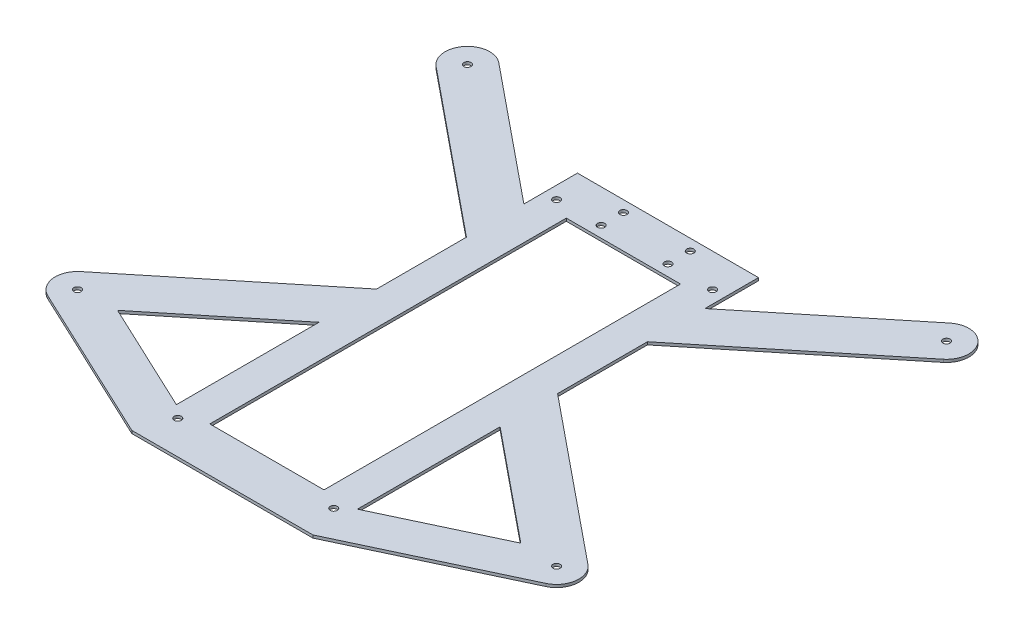
from build123d import *

# Parameters (mm, degrees)
SKETCH2_R           = 2.032
SKETCH2_W           = 65.0875
SKETCH2_H           = 203.2
BOSS_EXTRUDE1_DEPTH = 0.79375
SKETCH3_R           = 2.032
CUT_EXTRUDE1_DEPTH  = 223.550288208


with BuildPart() as part:
    # Sketch2 → Boss-Extrude1 (new, symmetric)
    with BuildSketch(Plane(origin=(0, 0, 0), x_dir=(1, 0, 0), z_dir=(0, 1, 0))):
        with BuildLine():
            Line((-51.59375, 58.370134809), (-128.507853241, 120.974637447))
            ThreePointArc((-128.507853241, 120.974637447), (-146.374637447, 119.142146759), (-144.542146759, 101.275362553))
            Line((-144.542146759, 101.275362553), (-51.59375, 25.619690772))
            Line((-51.59375, 25.619690772), (-51.59375, -25.619690772))
            Line((-51.59375, -25.619690772), (-144.542146759, -101.275362553))
            ThreePointArc((-144.542146759, -101.275362553), (-149.130906335, -112.668089589), (-141.929642552, -122.617599309))
            Line((-141.929642552, -122.617599309), (-51.59375, -165.1))
            Line((-51.59375, -165.1), (51.59375, -165.1))
            Line((51.59375, -165.1), (141.929642552, -122.617599309))
            ThreePointArc((141.929642552, -122.617599309), (149.130906335, -112.668089589), (144.542146759, -101.275362553))
            Line((144.542146759, -101.275362553), (51.59375, -25.619690772))
            Line((51.59375, -25.619690772), (51.59375, 25.619690772))
            Line((51.59375, 25.619690772), (144.542146759, 101.275362553))
            ThreePointArc((144.542146759, 101.275362553), (146.374637447, 119.142146759), (128.507853241, 120.974637447))
            Line((128.507853241, 120.974637447), (51.59375, 58.370134809))
            Line((51.59375, 58.370134809), (51.59375, 88.9))
            Line((51.59375, 88.9), (-51.59375, 88.9))
            Line((-51.59375, 88.9), (-51.59375, 58.370134809))
        make_face()
        with Locations((-136.525, -111.125)):
            Circle(SKETCH2_R, mode=Mode.SUBTRACT)
        Polygon((-51.59375, -58.370134809), (-51.59375, -139.7), (-114.923666817, -109.917741521), align=None, mode=Mode.SUBTRACT)
        Polygon((51.59375, -139.7), (51.59375, -58.370134809), (114.923666817, -109.917741521), align=None, mode=Mode.SUBTRACT)
        with Locations((136.525, -111.125)):
            Circle(SKETCH2_R, mode=Mode.SUBTRACT)
        with Locations((0, -38.1)):
            Rectangle(SKETCH2_W, SKETCH2_H, mode=Mode.SUBTRACT)
        with Locations((-136.525, 111.125)):
            Circle(SKETCH2_R, mode=Mode.SUBTRACT)
        with Locations((136.525, 111.125)):
            Circle(SKETCH2_R, mode=Mode.SUBTRACT)
    extrude(amount=BOSS_EXTRUDE1_DEPTH, both=True)

    # Sketch3 → Cut-Extrude1 (cut, through all)
    with BuildSketch(Plane.XZ.offset(0.79375)):
        with Locations((44.45, 146.05)):
            Circle(SKETCH3_R)
        with Locations((-44.45, 146.05)):
            Circle(SKETCH3_R)
        with Locations((44.45, -69.85)):
            Circle(SKETCH3_R)
        with Locations((-44.45, -69.85)):
            Circle(SKETCH3_R)
        with Locations((-19.05, -69.85)):
            Circle(SKETCH3_R)
        with Locations((19.05, -69.85)):
            Circle(SKETCH3_R)
        with Locations((-19.05, -82.55)):
            Circle(SKETCH3_R)
        with Locations((19.05, -82.55)):
            Circle(SKETCH3_R)
    extrude(amount=-CUT_EXTRUDE1_DEPTH, mode=Mode.SUBTRACT)


solid = part.part
